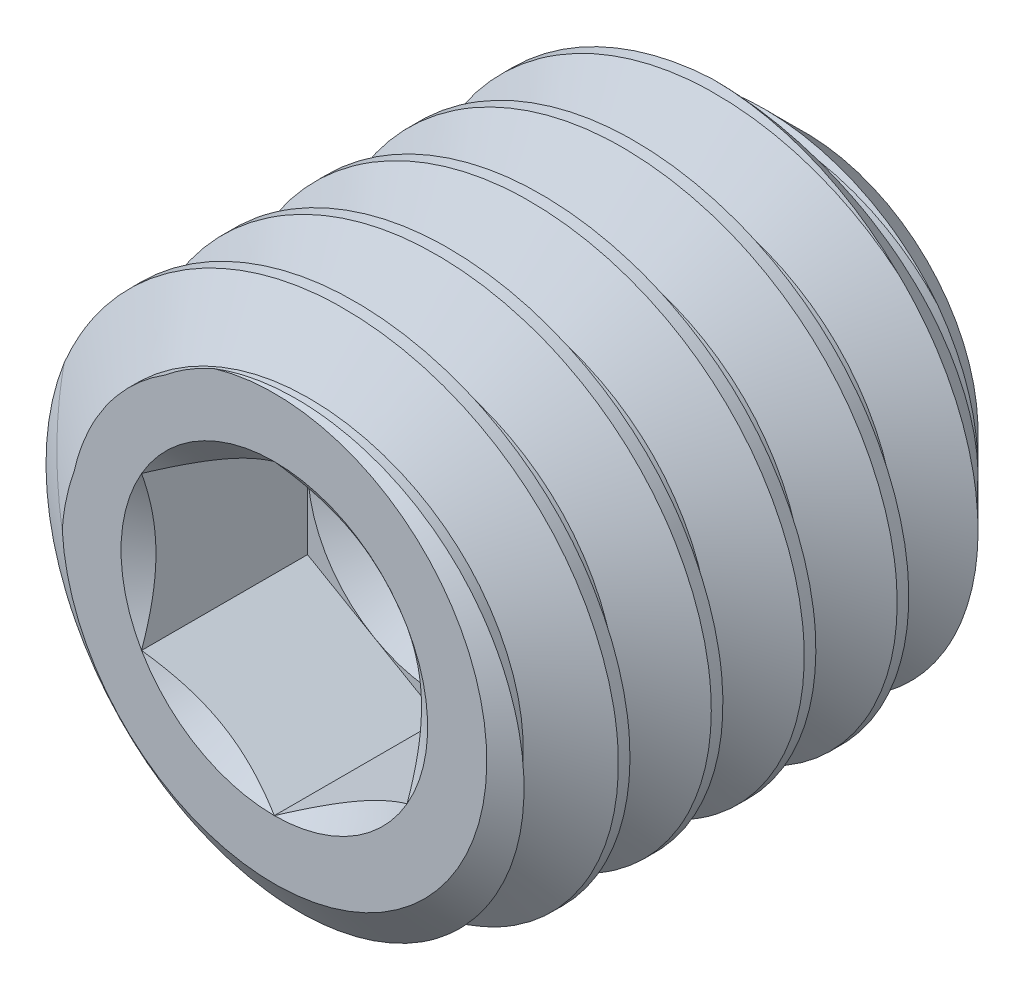
from build123d import *

# Parameters (mm, degrees)
CUT_EXTRUDE10_DEPTH = 1.25
CUT_SWEEP2_PITCH    = 0.7


with BuildPart() as part:
    # Sketch22 → Revolve1 (revolve)
    with BuildSketch(Plane(origin=(0, 0, 0), x_dir=(0, 0, -1), z_dir=(1, 0, 0)), mode=Mode.PRIVATE) as revolve1_sk:
        Polygon((-2, 0), (-2, 1.6), (-1.719916985, 2), (1.3, 2), (2, 1.3), (2, 0), align=None)
    revolve(revolve1_sk.sketch.rotate(Axis((0, 0, -2), (0, 0, 1)), 90), axis=Axis((0, 0, -2), (0, 0, 1)))

    # Sketch23 → Cut-Extrude10 (cut)
    with BuildSketch(Plane.XY.offset(2)):
        Polygon((0, 1.154700538), (-1, 0.577350269), (-1, -0.577350269), (0, -1.154700538), (1, -0.577350269), (1, 0.577350269), align=None)
    extrude(amount=-CUT_EXTRUDE10_DEPTH, mode=Mode.SUBTRACT)

    # Cut-Extrude11 cone 1 section (through the dimple's axis) → Cut-Extrude11 (revolve, cut)
    with BuildSketch(Plane(origin=(0, 0, 2), x_dir=(0, -1, 0), z_dir=(1, 0, 0))):
        Polygon((0, 0), (1.154700538, 0), (0, 0.808530021), align=None)
    revolve(axis=Axis((0, 0, 2), (0, 0, -1)), mode=Mode.SUBTRACT)

    # Cut-Extrude12 cone 1 section (through the dimple's axis) → Cut-Extrude12 (revolve, cut)
    with BuildSketch(Plane(origin=(0, 0, 0.75), x_dir=(0, -1, 0), z_dir=(1, 0, 0))):
        Polygon((0, 0), (1, 0), (0, 0.577350269), align=None)
    revolve(axis=Axis((0, 0, 0.75), (0, 0, -1)), mode=Mode.SUBTRACT)

    # Cut-Sweep2: the profile of Sketch28 profile screwed along a right-hand helix of 6.714286 turns, 6 arcs to a turn; built about Z, then put on its axis
    cut_sweep2_z = Axis((0, 0, 0), (0, 0, 1))
    cut_sweep2_corners = [(2.0003, 0, 0.000173205), (2.0003, 0, -0.612673205), (1.545336663, 0, -0.35), (1.545336663, 0, -0.2625)]
    with BuildLine(mode=Mode.PRIVATE) as cut_sweep2_profile:
        Line(cut_sweep2_corners[0], cut_sweep2_corners[1])
        Line(cut_sweep2_corners[1], cut_sweep2_corners[2])
        Line(cut_sweep2_corners[2], cut_sweep2_corners[3])
        Line(cut_sweep2_corners[3], cut_sweep2_corners[0])
    cut_sweep2_cap = Face(cut_sweep2_profile.wire())
    cut_sweep2_turn_angles = [0, 30, 60, 90, 120, 150, 180, 210, 240, 270, 300, 330, 360]
    cut_sweep2_turn_weights = [1, 0.8660254037844387, 1, 0.8660254037844387, 1, 0.8660254037844387, 1, 0.8660254037844387, 1, 0.8660254037844387, 1, 0.8660254037844387, 1]
    cut_sweep2_turn_rails = [Edge.make_bspline([Vector(p[0], p[1], 0).rotate(cut_sweep2_z, cut_sweep2_turn_angles[k]) / cut_sweep2_turn_weights[k] + Vector(0, 0, p[2] + CUT_SWEEP2_PITCH * cut_sweep2_turn_angles[k] / 360) for k in range(13)], [0, 0, 0, 1, 1, 2, 2, 3, 3, 4, 4, 5, 5, 6, 6, 6], 2, cut_sweep2_turn_weights) for p in cut_sweep2_corners]
    cut_sweep2_turn_sides = [Face.make_surface_from_curves(cut_sweep2_turn_rails[p[0]], cut_sweep2_turn_rails[p[1]]) for p in [(0, 1), (1, 2), (2, 3), (3, 0)]]
    cut_sweep2_last_angles = [2160, 2190, 2220, 2250, 2280, 2310, 2340, 2370, 2400, 2408.571428571, 2417.142857143]
    cut_sweep2_last_weights = [1, 0.8660254037844387, 1, 0.8660254037844387, 1, 0.8660254037844387, 1, 0.8660254037844387, 1, 0.988830826225126, 1]
    cut_sweep2_last_rails = [Edge.make_bspline([Vector(p[0], p[1], 0).rotate(cut_sweep2_z, cut_sweep2_last_angles[k]) / cut_sweep2_last_weights[k] + Vector(0, 0, p[2] + CUT_SWEEP2_PITCH * cut_sweep2_last_angles[k] / 360) for k in range(11)], [0, 0, 0, 1, 1, 2, 2, 3, 3, 4, 4, 5, 5, 5], 2, cut_sweep2_last_weights) for p in cut_sweep2_corners]
    cut_sweep2_last_sides = [Face.make_surface_from_curves(cut_sweep2_last_rails[p[0]], cut_sweep2_last_rails[p[1]]) for p in [(0, 1), (1, 2), (2, 3), (3, 0)]]
    cut_sweep2 = Plane(origin=(0, 0, -2), x_dir=(0, 1, 0), z_dir=(0, 0, 1)) * Solid(Shell([*[p.moved(Location((0, 0, CUT_SWEEP2_PITCH * i))) for i in range(6) for p in cut_sweep2_turn_sides], *cut_sweep2_last_sides, cut_sweep2_cap, cut_sweep2_cap.rotate(cut_sweep2_z, 2417.142857143).moved(Location((0, 0, CUT_SWEEP2_PITCH * 2417.142857143 / 360)))]))
    add(cut_sweep2, mode=Mode.SUBTRACT)


solid = part.part
